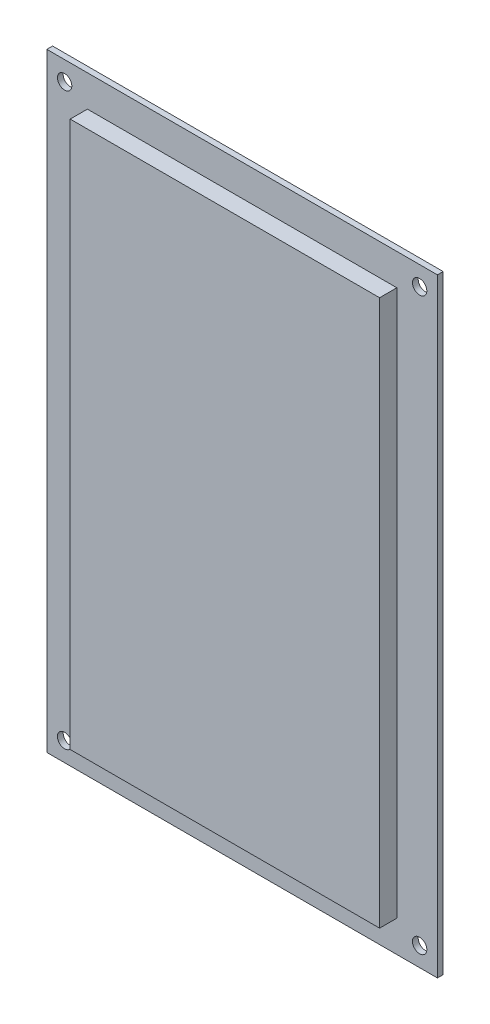
from build123d import *

# Parameters (mm, degrees)
SKETCH2_W           = 53.86
SKETCH2_H           = 95.04
BOSS_EXTRUDE1_DEPTH = 3
SKETCH3_W           = 68
SKETCH3_H           = 106
SKETCH3_R           = 1.25
BOSS_EXTRUDE2_DEPTH = 1


with BuildPart() as part:
    # Sketch2 → Boss-Extrude1 (new body)
    with BuildSketch(Plane.XY):
        with Locations((6.912993197, -3.934965986)):
            Rectangle(SKETCH2_W, SKETCH2_H)
    extrude(amount=BOSS_EXTRUDE1_DEPTH)

    # Sketch3 → Boss-Extrude2 (add)
    with BuildSketch(Plane(origin=(0, 0, 0), x_dir=(-1, 0, 0), z_dir=(0, 0, -1))):
        with Locations((-6.912993197, -3.934965986)):
            Rectangle(SKETCH3_W, SKETCH3_H)
        with Locations((23.987006803, 45.715034014)):
            Circle(SKETCH3_R, mode=Mode.SUBTRACT)
        with Locations((23.987006803, -53.584965986)):
            Circle(SKETCH3_R, mode=Mode.SUBTRACT)
        with Locations((-37.812993197, 45.715034014)):
            Circle(SKETCH3_R, mode=Mode.SUBTRACT)
        with Locations((-37.812993197, -53.584965986)):
            Circle(SKETCH3_R, mode=Mode.SUBTRACT)
    extrude(amount=BOSS_EXTRUDE2_DEPTH)


solid = part.part
